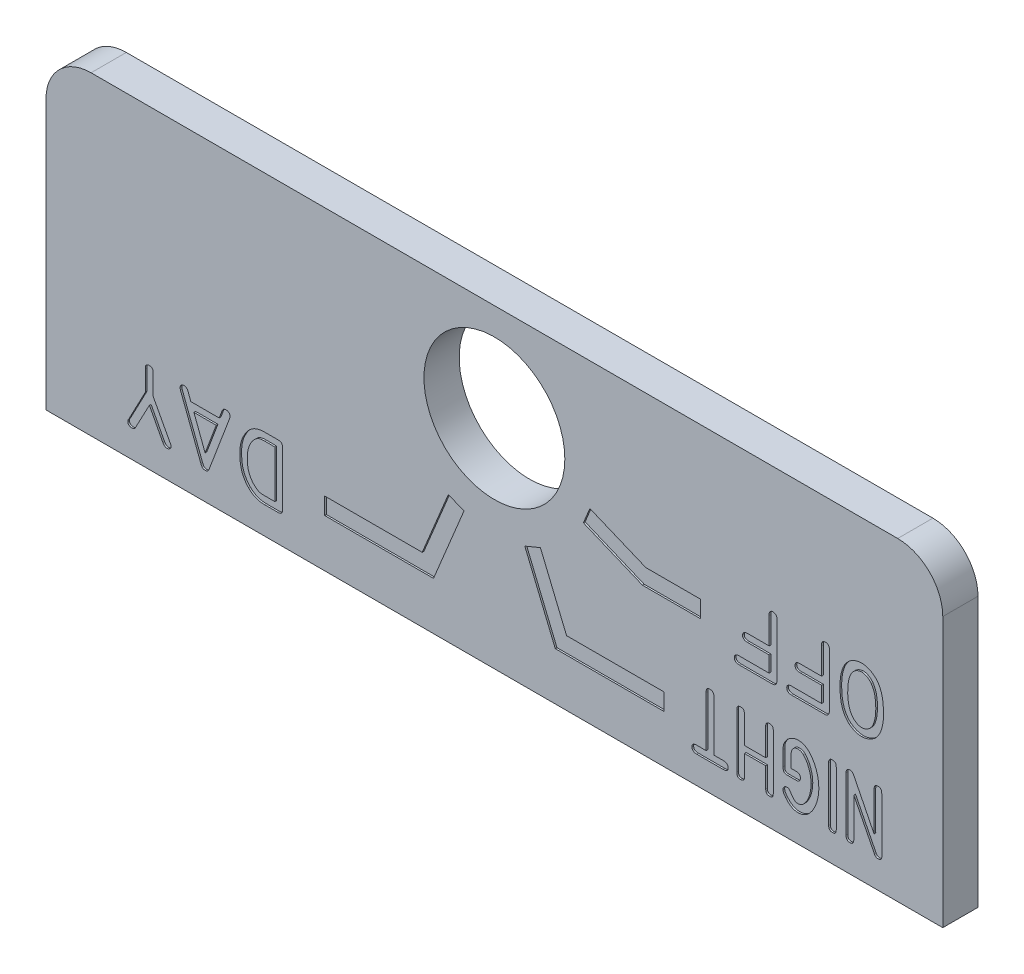
from build123d import *

# Parameters (mm, degrees)
BOSS_EXTRUDE1_DEPTH         = 1.5875
F_1_4_0_25_DIAMETER_HOLE1_D = 6.35
WRAP2_START                 = -0.0762
WRAP2_DEPTH                 = 0.0762


# Read off the part's stored shape, not the designer's step: Wrap2
with BuildPart() as part:
    # Sketch1 → Boss-Extrude1 (new body)
    with BuildSketch(Plane.XY):
        with BuildLine():
            Line((20.20887512, -175.895), (20.20887512, -163.750624988))
            ThreePointArc((20.20887512, -163.750624988), (19.613716099, -162.313784008), (18.17687512, -161.718624988))
            Line((18.17687512, -161.718624988), (-18.176874889, -161.718624988))
            ThreePointArc((-18.176874889, -161.718624988), (-19.613715868, -162.313784008), (-20.208874889, -163.750624988))
            Line((-20.208874889, -163.750624988), (-20.208874889, -175.895))
            Line((-20.208874889, -175.895), (20.20887512, -175.895))
        make_face()
    extrude(amount=BOSS_EXTRUDE1_DEPTH)

    # 1/4 (0.25) Diameter Hole1 (through all)
    with Locations(Plane.XY.offset(1.5875)):
        with Locations((1.87e-07, -166.116000205)):
            Hole(F_1_4_0_25_DIAMETER_HOLE1_D / 2)

    # Wrap2 outline → Wrap2 (cut)
    # profile 1 of 14: a face of its own
    with BuildSketch(Plane.XY.offset(1.5875).offset(WRAP2_START)):
        with BuildLine():
            Line((12.382324915, -169.873855094), (11.037261195, -169.873855094))
            add(Edge.make_bspline(
                [(11.037261195, -169.873855094), (11.019601092, -169.874120268), (10.986451526, -169.874618021), (10.940376467, -169.883636759), (10.900756518, -169.896491722), (10.868346228, -169.9162686), (10.842005802, -169.940923452), (10.824933637, -169.972611401), (10.813013862, -170.008694155), (10.811958214, -170.034880331), (10.811399257, -170.048745708)],
                knots=[0, 0, 0, 0, 0.162518303, 0.305061134, 0.431361212, 0.544321093, 0.652733849, 0.759548786, 0.872682952, 1, 1, 1, 1], degree=3))
            add(Edge.make_bspline(
                [(10.811399257, -170.048745708), (10.812202362, -170.062204438), (10.813743557, -170.088032335), (10.826164179, -170.123715108), (10.843720529, -170.154981547), (10.869953594, -170.179487921), (10.901789871, -170.199891023), (10.941446268, -170.212545557), (10.986932783, -170.221365963), (11.019490971, -170.222847938), (11.036784906, -170.223635119)],
                knots=[0, 0, 0, 0, 0.124823382, 0.239541572, 0.3482555, 0.454921392, 0.569877669, 0.697288114, 0.839208514, 1, 1, 1, 1], degree=3))
            Line((11.036784906, -170.223635119), (12.482269195, -170.223634517))
            add(Edge.make_bspline(
                [(12.482269195, -170.223634517), (12.501724882, -170.224780896), (12.538436193, -170.22694402), (12.590047374, -170.218900246), (12.634521684, -170.202859542), (12.671575932, -170.177252804), (12.698957465, -170.141071738), (12.719099456, -170.097257146), (12.730455334, -170.044584579), (12.731530808, -170.006720258), (12.732103736, -169.986549122)],
                knots=[0, 0, 0, 0, 0.144597592, 0.272843978, 0.385403949, 0.493830313, 0.602546429, 0.718652784, 0.850120297, 1, 1, 1, 1], degree=3))
            Line((12.732103736, -169.986549122), (12.732104338, -167.620497745))
            add(Edge.make_bspline(
                [(12.732104338, -167.620497745), (12.731912791, -167.603909367), (12.731595534, -167.576434248), (12.731036391, -167.540868779), (12.727431454, -167.513970644), (12.721911814, -167.498818004), (12.719171773, -167.49129598)],
                knots=[0, 0, 0, 0, 0.380827035, 0.630758982, 0.816702572, 1, 1, 1, 1], degree=3))
            add(Edge.make_bspline(
                [(12.719171773, -167.49129598), (12.71073442, -167.476714142), (12.694294767, -167.448302341), (12.656140939, -167.416477614), (12.609421512, -167.396543493), (12.575281655, -167.39286567), (12.557214325, -167.390919311)],
                knots=[0, 0, 0, 0, 0.25059774, 0.488274043, 0.729186872, 1, 1, 1, 1], degree=3))
            add(Edge.make_bspline(
                [(12.557214325, -167.390919311), (12.538709775, -167.392483071), (12.502258027, -167.395563492), (12.460436742, -167.415340682), (12.433178497, -167.43760065), (12.416084309, -167.45703149), (12.402965801, -167.47944466), (12.397438742, -167.495899087), (12.39464107, -167.504227943)],
                knots=[0, 0, 0, 0, 0.260463338, 0.513081557, 0.636553784, 0.755600026, 0.876290294, 1, 1, 1, 1], degree=3))
            add(Edge.make_bspline(
                [(12.39464107, -167.504227943), (12.391900622, -167.510920489), (12.386388784, -167.524381143), (12.382780357, -167.548656882), (12.382118502, -167.58078147), (12.382247261, -167.605629695), (12.382324915, -167.620615614)],
                knots=[0, 0, 0, 0, 0.183204339, 0.36847718, 0.619129726, 1, 1, 1, 1], degree=3))
            Line((12.382324915, -167.620615614), (12.382324915, -168.809739845))
            Line((12.382324915, -168.809739845), (11.437375086, -168.809739845))
            add(Edge.make_bspline(
                [(11.437375086, -168.809739845), (11.419395325, -168.809601751), (11.388841571, -168.809367084), (11.349550611, -168.812909192), (11.32039865, -168.816329708), (11.304216789, -168.820652554), (11.296655791, -168.822672409)],
                knots=[0, 0, 0, 0, 0.380151181, 0.646006656, 0.834596108, 1, 1, 1, 1], degree=3))
            add(Edge.make_bspline(
                [(11.296655791, -168.822672409), (11.28041719, -168.829885005), (11.24933757, -168.843689441), (11.213285339, -168.880800704), (11.190911838, -168.928490616), (11.187570273, -168.964052998), (11.18581039, -168.982782433)],
                knots=[0, 0, 0, 0, 0.25460758, 0.487302273, 0.729980427, 1, 1, 1, 1], degree=3))
            add(Edge.make_bspline(
                [(11.18581039, -168.982782433), (11.185961414, -168.997020326), (11.186246604, -169.023906712), (11.19702972, -169.061654716), (11.215846227, -169.09341808), (11.242925423, -169.118755774), (11.277497257, -169.13826977), (11.319904224, -169.151132317), (11.369623807, -169.159262205), (11.405206242, -169.159430025), (11.424128002, -169.159519267)],
                knots=[0, 0, 0, 0, 0.124834503, 0.235733518, 0.341050032, 0.445807504, 0.558269274, 0.68735626, 0.833744654, 1, 1, 1, 1], degree=3))
            Line((11.424128002, -169.159519267), (12.382324915, -169.159519267))
            Line((12.382324915, -169.159519267), (12.382324915, -169.873855094))
        make_face()
    # profile 2 of 14: a face of its own
    with BuildSketch(Plane.XY.offset(1.5875).offset(WRAP2_START)):
        with BuildLine():
            Line((14.747026806, -169.873855094), (13.401963087, -169.873855094))
            add(Edge.make_bspline(
                [(13.401963087, -169.873855094), (13.384302983, -169.874120268), (13.351153418, -169.874618021), (13.305078359, -169.883636759), (13.26545841, -169.896491722), (13.23304812, -169.9162686), (13.206707694, -169.940923452), (13.189635529, -169.972611401), (13.177715754, -170.008694155), (13.176660106, -170.034880331), (13.176101149, -170.048745708)],
                knots=[0, 0, 0, 0, 0.162518303, 0.305061134, 0.431361212, 0.544321093, 0.652733849, 0.759548786, 0.872682952, 1, 1, 1, 1], degree=3))
            add(Edge.make_bspline(
                [(13.176101149, -170.048745708), (13.176904254, -170.062204438), (13.178445448, -170.088032335), (13.19086607, -170.123715108), (13.208422421, -170.154981547), (13.234655486, -170.179487921), (13.266491763, -170.199891023), (13.306148159, -170.212545557), (13.351634674, -170.221365963), (13.384192863, -170.222847938), (13.401486798, -170.223635119)],
                knots=[0, 0, 0, 0, 0.124823382, 0.239541572, 0.3482555, 0.454921392, 0.569877669, 0.697288114, 0.839208514, 1, 1, 1, 1], degree=3))
            Line((13.401486798, -170.223635119), (14.846971087, -170.223634517))
            add(Edge.make_bspline(
                [(14.846971087, -170.223634517), (14.866426774, -170.224780896), (14.903138085, -170.22694402), (14.954749265, -170.218900246), (14.999223576, -170.202859542), (15.036277824, -170.177252804), (15.063659357, -170.141071738), (15.083801348, -170.097257146), (15.095157226, -170.044584579), (15.0962327, -170.006720258), (15.096805628, -169.986549122)],
                knots=[0, 0, 0, 0, 0.144597592, 0.272843978, 0.385403949, 0.493830313, 0.602546429, 0.718652784, 0.850120297, 1, 1, 1, 1], degree=3))
            Line((15.096805628, -169.986549122), (15.096806229, -167.620497745))
            add(Edge.make_bspline(
                [(15.096806229, -167.620497745), (15.096614682, -167.603909367), (15.096297426, -167.576434248), (15.095738283, -167.540868779), (15.092133345, -167.513970644), (15.086613706, -167.498818004), (15.083873664, -167.49129598)],
                knots=[0, 0, 0, 0, 0.380827035, 0.630758982, 0.816702572, 1, 1, 1, 1], degree=3))
            add(Edge.make_bspline(
                [(15.083873664, -167.49129598), (15.075436312, -167.476714142), (15.058996658, -167.448302341), (15.020842831, -167.416477614), (14.974123404, -167.396543493), (14.939983547, -167.39286567), (14.921916217, -167.390919311)],
                knots=[0, 0, 0, 0, 0.25059774, 0.488274043, 0.729186872, 1, 1, 1, 1], degree=3))
            add(Edge.make_bspline(
                [(14.921916217, -167.390919311), (14.903411666, -167.392483071), (14.866959919, -167.395563492), (14.825138634, -167.415340682), (14.797880389, -167.43760065), (14.780786201, -167.45703149), (14.767667693, -167.47944466), (14.762140634, -167.495899087), (14.759342962, -167.504227943)],
                knots=[0, 0, 0, 0, 0.260463338, 0.513081557, 0.636553784, 0.755600026, 0.876290294, 1, 1, 1, 1], degree=3))
            add(Edge.make_bspline(
                [(14.759342962, -167.504227943), (14.756602514, -167.510920489), (14.751090676, -167.524381143), (14.747482249, -167.548656882), (14.746820394, -167.58078147), (14.746949152, -167.605629695), (14.747026806, -167.620615614)],
                knots=[0, 0, 0, 0, 0.183204339, 0.36847718, 0.619129726, 1, 1, 1, 1], degree=3))
            Line((14.747026806, -167.620615614), (14.747026806, -168.809739845))
            Line((14.747026806, -168.809739845), (13.802076978, -168.809739845))
            add(Edge.make_bspline(
                [(13.802076978, -168.809739845), (13.784097217, -168.809601751), (13.753543463, -168.809367084), (13.714252503, -168.812909192), (13.685100542, -168.816329708), (13.66891868, -168.820652554), (13.661357683, -168.822672409)],
                knots=[0, 0, 0, 0, 0.380151181, 0.646006656, 0.834596108, 1, 1, 1, 1], degree=3))
            add(Edge.make_bspline(
                [(13.661357683, -168.822672409), (13.645119082, -168.829885005), (13.614039461, -168.843689441), (13.57798723, -168.880800704), (13.55561373, -168.928490616), (13.552272165, -168.964052998), (13.550512281, -168.982782433)],
                knots=[0, 0, 0, 0, 0.25460758, 0.487302273, 0.729980427, 1, 1, 1, 1], degree=3))
            add(Edge.make_bspline(
                [(13.550512281, -168.982782433), (13.550663306, -168.997020326), (13.550948496, -169.023906712), (13.561731612, -169.061654716), (13.580548119, -169.09341808), (13.607627315, -169.118755774), (13.642199148, -169.13826977), (13.684606115, -169.151132317), (13.734325699, -169.159262205), (13.769908133, -169.159430025), (13.788829894, -169.159519267)],
                knots=[0, 0, 0, 0, 0.124834503, 0.235733518, 0.341050032, 0.445807504, 0.558269274, 0.68735626, 0.833744654, 1, 1, 1, 1], degree=3))
            Line((13.788829894, -169.159519267), (14.747026806, -169.159519267))
            Line((14.747026806, -169.159519267), (14.747026806, -169.873855094))
        make_face()
    # profile 3 of 14: a face of its own
    with BuildSketch(Plane.XY.offset(1.5875).offset(WRAP2_START)):
        with BuildLine():
            add(Edge.make_bspline(
                [(16.555343358, -170.263046216), (16.583829028, -170.261807187), (16.641466414, -170.259300159), (16.727962728, -170.244150535), (16.81448131, -170.21886346), (16.90090388, -170.186149043), (16.984302842, -170.144333832), (17.06357126, -170.096464295), (17.136770095, -170.041473184), (17.180863052, -169.999904736), (17.20286825, -169.979159428)],
                knots=[0, 0, 0, 0, 0.118093103, 0.23894744, 0.362830703, 0.491295328, 0.621428395, 0.748962669, 0.874716356, 1, 1, 1, 1], degree=3))
            add(Edge.make_bspline(
                [(17.20286825, -169.979159428), (17.229781975, -169.946937962), (17.284557589, -169.881359873), (17.352279603, -169.769253388), (17.410678652, -169.645738394), (17.45755369, -169.509925701), (17.494096425, -169.362908355), (17.521181008, -169.205706736), (17.537176617, -169.038331151), (17.53926098, -168.92349466), (17.540330916, -168.864547339)],
                knots=[0, 0, 0, 0, 0.105704853, 0.215133666, 0.329018149, 0.449630503, 0.576639017, 0.710540967, 0.851416267, 1, 1, 1, 1], degree=3))
            add(Edge.make_bspline(
                [(17.540330916, -168.864547339), (17.539544841, -168.804791391), (17.538019349, -168.688826386), (17.525110912, -168.520596771), (17.503427343, -168.363554219), (17.474902346, -168.217255797), (17.4351981, -168.082705324), (17.387668346, -167.959253803), (17.332583093, -167.846219636), (17.286792, -167.778612384), (17.264449029, -167.745624595)],
                knots=[0, 0, 0, 0, 0.153117218, 0.297145964, 0.432018517, 0.559217347, 0.678730148, 0.790971852, 0.898008332, 1, 1, 1, 1], degree=3))
            add(Edge.make_bspline(
                [(17.264449029, -167.745624595), (17.242674982, -167.720404133), (17.198814706, -167.669601616), (17.12121664, -167.603414659), (17.035782664, -167.543199703), (16.942696643, -167.491055559), (16.845003816, -167.448092161), (16.745771241, -167.416466664), (16.646111665, -167.396665929), (16.579549413, -167.39282913), (16.546417152, -167.390919311)],
                knots=[0, 0, 0, 0, 0.121091611, 0.24391935, 0.369915463, 0.501015774, 0.631465458, 0.757614252, 0.879349214, 1, 1, 1, 1], degree=3))
            add(Edge.make_bspline(
                [(16.546417152, -167.390919311), (16.520303473, -167.392062945), (16.467603845, -167.394370897), (16.388404607, -167.407124601), (16.308799682, -167.427421556), (16.229880244, -167.455971601), (16.152859231, -167.490250601), (16.080315525, -167.532368146), (16.011544006, -167.579029811), (15.970261659, -167.615832434), (15.949699409, -167.634163386)],
                knots=[0, 0, 0, 0, 0.119016937, 0.240186307, 0.364723616, 0.49281703, 0.622160895, 0.748261788, 0.874612166, 1, 1, 1, 1], degree=3))
            add(Edge.make_bspline(
                [(15.949699409, -167.634163386), (15.919437971, -167.66688265), (15.858017062, -167.733292148), (15.781342177, -167.8486869), (15.716320338, -167.977063926), (15.664522075, -168.119326104), (15.623059011, -168.274425183), (15.594913582, -168.443309258), (15.577414991, -168.625446352), (15.575607078, -168.751401315), (15.574672468, -168.816514332)],
                knots=[0, 0, 0, 0, 0.104917106, 0.212947712, 0.325253939, 0.443443112, 0.569142725, 0.70317811, 0.846556515, 1, 1, 1, 1], degree=3))
            add(Edge.make_bspline(
                [(15.574672468, -168.816514332), (15.574769759, -168.85265065), (15.574960569, -168.923522661), (15.580556857, -169.027593968), (15.587074002, -169.127749195), (15.59947343, -169.223533904), (15.612985074, -169.315527109), (15.631235774, -169.403155305), (15.651726885, -169.486973927), (15.676618217, -169.566392001), (15.703952515, -169.641897233), (15.73595613, -169.712596722), (15.769124287, -169.780376721), (15.807998264, -169.842809234), (15.848190773, -169.902503396), (15.892854817, -169.957141566), (15.940126856, -170.008296278), (15.974867696, -170.038574745), (15.992190146, -170.05367217)],
                knots=[0, 0, 0, 0, 0.080430845, 0.157744227, 0.231975202, 0.30378836, 0.372682398, 0.438910646, 0.502970405, 0.56468761, 0.624108737, 0.681595454, 0.73738624, 0.791931734, 0.845167542, 0.897479435, 0.948881277, 1, 1, 1, 1], degree=3))
            add(Edge.make_bspline(
                [(15.992190146, -170.05367217), (16.013091421, -170.06961414), (16.054606896, -170.10127912), (16.120992712, -170.142605196), (16.190156828, -170.178488691), (16.261869603, -170.20843554), (16.334918814, -170.232565326), (16.408278592, -170.24974137), (16.481628584, -170.260805487), (16.530573096, -170.262299847), (16.555038461, -170.263046817)],
                knots=[0, 0, 0, 0, 0.128897167, 0.256023952, 0.383031035, 0.510762582, 0.636864263, 0.759967113, 0.880017352, 1, 1, 1, 1], degree=3))
            Line((16.555038461, -170.263046817), (16.555343358, -170.263046216))
        make_face()
        with BuildLine():
            add(Edge.make_bspline(
                [(16.213880949, -169.769784782), (16.190319642, -169.745597933), (16.142400416, -169.696406475), (16.083659124, -169.608540487), (16.033201998, -169.509615843), (15.993349048, -169.398065614), (15.961047589, -169.275135714), (15.939820003, -169.140002636), (15.925702224, -168.993144023), (15.92487879, -168.891064112), (15.92445129, -168.838067604)],
                knots=[0, 0, 0, 0, 0.100870888, 0.205152237, 0.314772278, 0.432547495, 0.558900519, 0.694634529, 0.841464361, 1, 1, 1, 1], degree=3))
            add(Edge.make_bspline(
                [(15.92445129, -168.838067604), (15.925178551, -168.786529117), (15.926576743, -168.687444107), (15.93665406, -168.544864882), (15.954913114, -168.414587264), (15.980627424, -168.296144602), (16.013667162, -168.188519412), (16.05506446, -168.091637656), (16.103048203, -168.003944739), (16.14316622, -167.953277035), (16.162768903, -167.928519507)],
                knots=[0, 0, 0, 0, 0.161184797, 0.309884867, 0.446706464, 0.572255575, 0.688604116, 0.798190394, 0.901390696, 1, 1, 1, 1], degree=3))
            add(Edge.make_bspline(
                [(16.162768903, -167.928519507), (16.175832097, -167.915076408), (16.202135472, -167.888008077), (16.24686048, -167.852849179), (16.294363886, -167.820115015), (16.345694434, -167.793243489), (16.397912923, -167.770070846), (16.450958511, -167.754324567), (16.503045718, -167.743017288), (16.537944915, -167.741460596), (16.555038461, -167.740698132)],
                knots=[0, 0, 0, 0, 0.125942977, 0.253592282, 0.381874678, 0.513443514, 0.64270292, 0.765426277, 0.885106335, 1, 1, 1, 1], degree=3))
            add(Edge.make_bspline(
                [(16.555038461, -167.740698132), (16.574804594, -167.741829486), (16.614490683, -167.744100998), (16.67370388, -167.756943016), (16.732586447, -167.777499954), (16.790533737, -167.805784468), (16.846232455, -167.840475757), (16.89760561, -167.881639642), (16.944983738, -167.92768174), (16.971932354, -167.962655026), (16.985488102, -167.98024736)],
                knots=[0, 0, 0, 0, 0.116371412, 0.233648452, 0.355136566, 0.482643676, 0.612357711, 0.740458571, 0.869444931, 1, 1, 1, 1], degree=3))
            add(Edge.make_bspline(
                [(16.985488102, -167.98024736), (17.00250021, -168.005553401), (17.03730111, -168.057320822), (17.079416709, -168.143736481), (17.114384836, -168.238524792), (17.14271767, -168.341971352), (17.163879765, -168.455304484), (17.17989159, -168.578834124), (17.188902873, -168.71354007), (17.189988394, -168.806853476), (17.190552095, -168.855310222)],
                knots=[0, 0, 0, 0, 0.100095779, 0.204761407, 0.314882772, 0.431712838, 0.556714231, 0.693410658, 0.840791131, 1, 1, 1, 1], degree=3))
            add(Edge.make_bspline(
                [(17.190552095, -168.855310222), (17.189734435, -168.904192525), (17.188147906, -168.999040272), (17.175656066, -169.1366603), (17.155791862, -169.264958456), (17.127500608, -169.383343068), (17.092554995, -169.491100424), (17.049450969, -169.5866355), (16.999337325, -169.670033075), (16.958457869, -169.716929138), (16.938686711, -169.7396102)],
                knots=[0, 0, 0, 0, 0.156015182, 0.302720772, 0.440715865, 0.570082732, 0.690883956, 0.801726531, 0.904105964, 1, 1, 1, 1], degree=3))
            add(Edge.make_bspline(
                [(16.938686711, -169.7396102), (16.926019458, -169.752023918), (16.900466644, -169.777065292), (16.856682002, -169.809533013), (16.809380068, -169.839096459), (16.758728891, -169.864802688), (16.706638414, -169.885172222), (16.655109639, -169.901161613), (16.604689097, -169.910535402), (16.571395567, -169.912370029), (16.555199101, -169.913259177)],
                knots=[0, 0, 0, 0, 0.123371767, 0.248869729, 0.378562781, 0.511522779, 0.643704529, 0.767605082, 0.886756388, 0.999626843, 0.999626843, 0.999626843, 0.999626843], degree=3))
            add(Edge.make_bspline(
                [(16.555199101, -169.913259177), (16.540754854, -169.912496609), (16.511342744, -169.910938554), (16.466767103, -169.903625052), (16.421669669, -169.890070585), (16.360982805, -169.867612203), (16.288594792, -169.830347802), (16.238517279, -169.789754984), (16.213880949, -169.769784782)],
                knots=[0.000382455, 0.000382455, 0.000382455, 0.000382455, 0.115265933, 0.234317535, 0.3582089, 0.488780363, 0.748498375, 1, 1, 1, 1], degree=3))
        make_face(mode=Mode.SUBTRACT)
    # profile 4 of 14: a face of its own
    with BuildSketch(Plane.XY.offset(1.5875).offset(WRAP2_START)):
        with BuildLine():
            Line((9.544353084, -174.316399015), (9.122956539, -174.316399015))
            add(Edge.make_bspline(
                [(9.122956539, -174.316399015), (9.105947805, -174.317016313), (9.073919206, -174.318178728), (9.029330538, -174.325945124), (8.9912611, -174.338823208), (8.959542138, -174.357093596), (8.935544926, -174.382208624), (8.917633709, -174.411687223), (8.907883348, -174.446987078), (8.906494714, -174.47193776), (8.905760412, -174.48513155)],
                knots=[0, 0, 0, 0, 0.162897657, 0.306747336, 0.431731416, 0.546374995, 0.653433857, 0.760997037, 0.873616484, 1, 1, 1, 1], degree=3))
            add(Edge.make_bspline(
                [(8.905760412, -174.48513155), (8.906463754, -174.499362046), (8.907787883, -174.526152748), (8.917800962, -174.563773561), (8.934400677, -174.595799955), (8.958066578, -174.621886785), (8.988034053, -174.642110694), (9.02447241, -174.655948351), (9.067113047, -174.664606715), (9.097640165, -174.665632535), (9.113903443, -174.666179039)],
                knots=[0, 0, 0, 0, 0.13549594, 0.255088173, 0.36798027, 0.476021954, 0.587257675, 0.709320559, 0.84514094, 1, 1, 1, 1], degree=3))
            Line((9.113903443, -174.666179039), (10.30275946, -174.666178438))
            add(Edge.make_bspline(
                [(10.30275946, -174.666178438), (10.320950504, -174.66610885), (10.354992388, -174.665978627), (10.402516806, -174.657691918), (10.442911716, -174.645092533), (10.477038, -174.627604799), (10.502227483, -174.602406123), (10.52105226, -174.572747121), (10.530675546, -174.536810105), (10.531613423, -174.511455003), (10.53210877, -174.498063514)],
                knots=[0, 0, 0, 0, 0.167323449, 0.313121427, 0.442287347, 0.556528349, 0.662166905, 0.766596956, 0.876726412, 1, 1, 1, 1], degree=3))
            add(Edge.make_bspline(
                [(10.53210877, -174.498063514), (10.531409289, -174.483829217), (10.530092426, -174.457031359), (10.520030625, -174.419458525), (10.503535124, -174.387141951), (10.47892384, -174.361372078), (10.44879771, -174.340345899), (10.411310678, -174.326590718), (10.367671221, -174.31798434), (10.336329452, -174.316950329), (10.319655085, -174.316400217)],
                knots=[0, 0, 0, 0, 0.13367795, 0.251665576, 0.363042966, 0.47093762, 0.583363643, 0.705585, 0.843366093, 1, 1, 1, 1], degree=3))
            Line((10.319655085, -174.316400217), (9.894132507, -174.316399015))
            Line((9.894132507, -174.316399015), (9.894132507, -172.070548025))
            add(Edge.make_bspline(
                [(9.894132507, -172.070548025), (9.894260497, -172.057202432), (9.894494893, -172.032761794), (9.893057295, -171.999518673), (9.891639227, -171.972719284), (9.887656716, -171.946395999), (9.880182364, -171.918339056), (9.866835453, -171.901080251), (9.860262478, -171.892580778)],
                knots=[0, 0, 0, 0, 0.216060692, 0.395685733, 0.538969935, 0.649917571, 0.82759431, 1, 1, 1, 1], degree=3))
            add(Edge.make_bspline(
                [(9.860262478, -171.892580778), (9.850959755, -171.883721002), (9.832443218, -171.866086125), (9.79806552, -171.847297162), (9.758931395, -171.836073373), (9.731226259, -171.834357817), (9.716779264, -171.833463231)],
                knots=[0, 0, 0, 0, 0.240761183, 0.479221355, 0.728437127, 1, 1, 1, 1], degree=3))
            add(Edge.make_bspline(
                [(9.716779264, -171.833463231), (9.70277088, -171.833257304), (9.67647633, -171.832870765), (9.63951865, -171.841662966), (9.608126681, -171.857766344), (9.583368964, -171.882616517), (9.563872878, -171.914101142), (9.551576809, -171.953190019), (9.54397161, -171.999019225), (9.544219702, -172.031922045), (9.544353084, -172.049611763)],
                knots=[0, 0, 0, 0, 0.1303468, 0.244668505, 0.350952396, 0.455284039, 0.568004952, 0.693428508, 0.835176339, 1, 1, 1, 1], degree=3))
            Line((9.544353084, -172.049611763), (9.544353084, -174.316399015))
        make_face()
    # profile 5 of 14: a face of its own
    with BuildSketch(Plane.XY.offset(1.5875).offset(WRAP2_START)):
        with BuildLine():
            Line((12.228043408, -173.562650888), (12.228043408, -174.469104311))
            add(Edge.make_bspline(
                [(12.228043408, -174.469104311), (12.228319522, -174.485172157), (12.228837533, -174.515316714), (12.237684474, -174.557069012), (12.2509649, -174.592316986), (12.269835925, -174.621482376), (12.295105158, -174.643406481), (12.325799212, -174.658591981), (12.361887664, -174.6665731), (12.387500575, -174.666315609), (12.401085396, -174.666179039)],
                knots=[0, 0, 0, 0, 0.158754578, 0.297836197, 0.420091928, 0.529986913, 0.637987015, 0.747033378, 0.865829146, 1, 1, 1, 1], degree=3))
            add(Edge.make_bspline(
                [(12.401085396, -174.666179039), (12.415113182, -174.666185857), (12.441237271, -174.666198556), (12.477304308, -174.657018261), (12.507889546, -174.643381852), (12.532050147, -174.621517309), (12.550335121, -174.592682255), (12.562165797, -174.555682843), (12.569334458, -174.510866614), (12.570046954, -174.4781854), (12.570432536, -174.460499239)],
                knots=[0, 0, 0, 0, 0.135176046, 0.251739713, 0.357443824, 0.455903755, 0.562221727, 0.68406271, 0.82902355, 1, 1, 1, 1], degree=3))
            Line((12.570432536, -174.460499239), (12.570433138, -172.027671206))
            add(Edge.make_bspline(
                [(12.570433138, -172.027671206), (12.570548202, -172.011953978), (12.570765783, -171.982233493), (12.563110912, -171.940894047), (12.551410458, -171.905237136), (12.53243559, -171.876587395), (12.507584204, -171.854798488), (12.476700609, -171.84032676), (12.440408075, -171.833300901), (12.414659039, -171.833407197), (12.401085396, -171.833463231)],
                knots=[0, 0, 0, 0, 0.156476393, 0.295888969, 0.417683259, 0.528456213, 0.634429154, 0.743446119, 0.864757234, 1, 1, 1, 1], degree=3))
            add(Edge.make_bspline(
                [(12.401085396, -171.833463231), (12.387101057, -171.833396118), (12.360740177, -171.833269608), (12.323646864, -171.840330718), (12.292171767, -171.854780936), (12.266672228, -171.876530509), (12.247149775, -171.905176567), (12.234404469, -171.940703163), (12.227981931, -171.982453842), (12.228022073, -172.012231686), (12.228043408, -172.028058491)],
                knots=[0, 0, 0, 0, 0.137644544, 0.259463909, 0.36898459, 0.475203523, 0.585765865, 0.706776014, 0.844152622, 1, 1, 1, 1], degree=3))
            Line((12.228043408, -172.028058491), (12.228043408, -173.252283765))
            Line((12.228043408, -173.252283765), (11.269847097, -173.252283765))
            Line((11.269847097, -173.252283765), (11.269847097, -172.044858497))
            add(Edge.make_bspline(
                [(11.269847097, -172.044858497), (11.269730357, -172.026493179), (11.269513069, -171.992309778), (11.262060349, -171.945740883), (11.251251682, -171.907380998), (11.233324954, -171.877969324), (11.209122139, -171.856290965), (11.178398414, -171.842498779), (11.141661237, -171.83343065), (11.114934088, -171.833451806), (11.100499355, -171.833463231)],
                knots=[0, 0, 0, 0, 0.17354588, 0.323021273, 0.445288841, 0.548252678, 0.644568978, 0.74797174, 0.863885195, 1, 1, 1, 1], degree=3))
            add(Edge.make_bspline(
                [(11.100499355, -171.833463231), (11.085693624, -171.833834763), (11.058282939, -171.834522601), (11.020051284, -171.842003206), (10.989061199, -171.857094521), (10.963895617, -171.878281565), (10.946389189, -171.908005402), (10.934402745, -171.944915404), (10.928018217, -171.990277842), (10.92765508, -172.023113075), (10.927457368, -172.040990454)],
                knots=[0, 0, 0, 0, 0.140408875, 0.259946867, 0.366185458, 0.464181939, 0.56737934, 0.688680431, 0.830499811, 1, 1, 1, 1], degree=3))
            Line((10.927457368, -172.040990454), (10.927457368, -174.469104311))
            add(Edge.make_bspline(
                [(10.927457368, -174.469104311), (10.927589655, -174.485772884), (10.927836206, -174.51683919), (10.935201194, -174.559602118), (10.946924329, -174.595200703), (10.965417761, -174.623177557), (10.990062492, -174.64352043), (11.020132183, -174.658138951), (11.056399894, -174.665800164), (11.082403116, -174.666047771), (11.096188701, -174.666179039)],
                knots=[0, 0, 0, 0, 0.165150309, 0.307801387, 0.42892022, 0.534561023, 0.635748817, 0.742327972, 0.863395415, 1, 1, 1, 1], degree=3))
            add(Edge.make_bspline(
                [(11.096188701, -174.666179039), (11.109599117, -174.665669483), (11.135333045, -174.664691671), (11.171307986, -174.655063012), (11.203203744, -174.640931014), (11.230135921, -174.620524674), (11.250731783, -174.593874885), (11.26546058, -174.562659789), (11.271127719, -174.526164046), (11.270289777, -174.500939088), (11.269846496, -174.487594781)],
                knots=[0, 0, 0, 0, 0.139999091, 0.268651369, 0.386841275, 0.503242258, 0.617947069, 0.736136976, 0.860413278, 1, 1, 1, 1], degree=3))
            Line((11.269846496, -174.487594781), (11.269847097, -174.478408782))
            Line((11.269847097, -174.478408782), (11.269847097, -173.562650888))
            Line((11.269847097, -173.562650888), (12.228043408, -173.562650888))
        make_face()
    # profile 6 of 14: a face of its own
    with BuildSketch(Plane.XY.offset(1.5875).offset(WRAP2_START)):
        with BuildLine():
            Line((13.361990299, -173.094636972), (13.361990299, -172.651857945))
            add(Edge.make_bspline(
                [(13.361990299, -172.651857945), (13.363112819, -172.615665904), (13.365230092, -172.547401279), (13.380996666, -172.452124543), (13.406123417, -172.370608548), (13.442301036, -172.303428222), (13.488439333, -172.249509837), (13.546511923, -172.21193246), (13.614116898, -172.188100781), (13.662664881, -172.184913485), (13.688123665, -172.183242053)],
                knots=[0, 0, 0, 0, 0.168347535, 0.317533382, 0.448032111, 0.563451919, 0.6703855, 0.774504603, 0.88174918, 1, 1, 1, 1], degree=3))
            add(Edge.make_bspline(
                [(13.688123665, -172.183242053), (13.710860947, -172.18501766), (13.755542394, -172.188506938), (13.819719788, -172.209223317), (13.879311591, -172.241179133), (13.913029935, -172.271377398), (13.930136124, -172.28669776)],
                knots=[0, 0, 0, 0, 0.253184607, 0.497537694, 0.745087852, 1, 1, 1, 1], degree=3))
            add(Edge.make_bspline(
                [(13.930136124, -172.28669776), (13.956020126, -172.316780766), (14.008470779, -172.377740167), (14.076533527, -172.480167609), (14.133998946, -172.593898727), (14.183557484, -172.716229176), (14.223347439, -172.845615467), (14.252406356, -172.979679033), (14.269971107, -173.117368207), (14.272488523, -173.210359289), (14.273756868, -173.257210828)],
                knots=[0, 0, 0, 0, 0.113066692, 0.229115332, 0.349509146, 0.47578399, 0.604987759, 0.734921021, 0.866445706, 1, 1, 1, 1], degree=3))
            add(Edge.make_bspline(
                [(14.273756868, -173.257210828), (14.272744775, -173.291106173), (14.270747251, -173.358003975), (14.260414533, -173.456846672), (14.245924365, -173.55268125), (14.226138639, -173.645413634), (14.201501554, -173.734871774), (14.171929004, -173.821556375), (14.136887474, -173.905053537), (14.097270111, -173.984517953), (14.054160141, -174.057650222), (14.00872719, -174.122938132), (13.960624601, -174.178682588), (13.910576091, -174.225312038), (13.858633676, -174.263267992), (13.803643054, -174.290178331), (13.747048767, -174.309996383), (13.707779592, -174.31426406), (13.688123665, -174.316400217)],
                knots=[0, 0, 0, 0, 0.077929163, 0.153805484, 0.228283808, 0.300657576, 0.371634944, 0.441472223, 0.511055568, 0.579639748, 0.645433537, 0.706048624, 0.762247154, 0.814337373, 0.863047886, 0.9094741, 0.954687857, 1, 1, 1, 1], degree=3))
            add(Edge.make_bspline(
                [(13.688123665, -174.316400217), (13.672446585, -174.316000232), (13.641243138, -174.315204106), (13.595486013, -174.3027571), (13.551843453, -174.282241527), (13.510019274, -174.25192564), (13.468931496, -174.211412072), (13.427566919, -174.15943403), (13.382855892, -174.097379353), (13.355007051, -174.050615808), (13.340192267, -174.025738943)],
                knots=[0, 0, 0, 0, 0.098370228, 0.195794771, 0.29574629, 0.400393971, 0.519132588, 0.657714484, 0.817913924, 1, 1, 1, 1], degree=3))
            add(Edge.make_bspline(
                [(13.340192267, -174.025738943), (13.334466798, -174.015936958), (13.323785639, -173.997650843), (13.305437753, -173.974215234), (13.28851746, -173.95462139), (13.265640493, -173.935682601), (13.231967492, -173.919657279), (13.202877871, -173.91815329), (13.187471936, -173.917356773)],
                knots=[0, 0, 0, 0, 0.171621566, 0.320168961, 0.4499824, 0.562586526, 0.768344755, 1, 1, 1, 1], degree=3))
            add(Edge.make_bspline(
                [(13.187471936, -173.917356773), (13.174884924, -173.918330535), (13.150496656, -173.92021727), (13.115528252, -173.930719358), (13.085011415, -173.949245015), (13.058223448, -173.973343784), (13.036864744, -174.00313867), (13.020555317, -174.036802589), (13.010419306, -174.074641156), (13.009006508, -174.101213684), (13.008271871, -174.115031072)],
                knots=[0, 0, 0, 0, 0.127211996, 0.246482662, 0.364450575, 0.484724738, 0.607803529, 0.731976066, 0.86063084, 1, 1, 1, 1], degree=3))
            add(Edge.make_bspline(
                [(13.008271871, -174.115031072), (13.009289427, -174.1314159), (13.011452859, -174.166251755), (13.029095316, -174.209052213), (13.049036694, -174.246745856), (13.070785407, -174.27980035), (13.096793707, -174.318126702), (13.116908026, -174.344223387), (13.127738581, -174.358275147)],
                knots=[0, 0, 0, 0, 0.177504855, 0.377393872, 0.496239419, 0.641777771, 0.807115248, 1, 1, 1, 1], degree=3))
            add(Edge.make_bspline(
                [(13.127738581, -174.358275147), (13.149134487, -174.383233045), (13.190470015, -174.431450113), (13.256242045, -174.496027461), (13.323966149, -174.549358295), (13.392513389, -174.593317938), (13.463865872, -174.626342047), (13.537443306, -174.649941878), (13.6141055, -174.663894708), (13.666102923, -174.665411127), (13.692434319, -174.666179039)],
                knots=[0, 0, 0, 0, 0.147817219, 0.285573448, 0.413753257, 0.534904836, 0.650968732, 0.766295941, 0.881652708, 1, 1, 1, 1], degree=3))
            add(Edge.make_bspline(
                [(13.692434319, -174.666179039), (13.711959212, -174.665483446), (13.751163722, -174.664086748), (13.809739536, -174.655961717), (13.868072471, -174.642325985), (13.925525066, -174.622989132), (13.981842243, -174.60020958), (14.03477311, -174.572178672), (14.084680189, -174.541045457), (14.114710461, -174.516459234), (14.129657846, -174.504221592)],
                knots=[0, 0, 0, 0, 0.12322214, 0.247420742, 0.372467494, 0.50067428, 0.629605311, 0.755327797, 0.8782159, 1, 1, 1, 1], degree=3))
            add(Edge.make_bspline(
                [(14.129657846, -174.504221592), (14.148358955, -174.48617582), (14.186102981, -174.449754445), (14.238820315, -174.390740066), (14.288267355, -174.327368344), (14.334913425, -174.260668785), (14.378331208, -174.189637913), (14.418937978, -174.114961512), (14.455583117, -174.035681172), (14.501829493, -173.925998478), (14.548849037, -173.783362232), (14.591303689, -173.607810693), (14.61712272, -173.427726436), (14.620977724, -173.306146736), (14.622919881, -173.244894673)],
                knots=[0, 0, 0, 0, 0.056143524, 0.113313213, 0.170812333, 0.229752765, 0.289090758, 0.350616575, 0.413320695, 0.47773966, 0.607767051, 0.737299464, 0.867651017, 1, 1, 1, 1], degree=3))
            add(Edge.make_bspline(
                [(14.622919881, -173.244894673), (14.621870685, -173.19990927), (14.619772477, -173.109946427), (14.605974131, -172.975765387), (14.583118754, -172.842649843), (14.55105645, -172.711707638), (14.511637789, -172.584120006), (14.463447442, -172.462473695), (14.407567506, -172.347269767), (14.363818647, -172.27509294), (14.342111532, -172.239280561)],
                knots=[0, 0, 0, 0, 0.127601016, 0.255179445, 0.382206594, 0.510437087, 0.637324037, 0.760694093, 0.881262255, 1, 1, 1, 1], degree=3))
            add(Edge.make_bspline(
                [(14.342111532, -172.239280561), (14.31992588, -172.206812276), (14.277115267, -172.144159744), (14.205237301, -172.060429852), (14.129936332, -171.989397694), (14.050683727, -171.931681426), (13.968296488, -171.886408023), (13.881989085, -171.855604204), (13.792663018, -171.836142498), (13.731740786, -171.834360688), (13.701055628, -171.833463231)],
                knots=[0, 0, 0, 0, 0.148531195, 0.2866137, 0.416148245, 0.538890943, 0.656218703, 0.770086885, 0.884197936, 1, 1, 1, 1], degree=3))
            add(Edge.make_bspline(
                [(13.701055628, -171.833463231), (13.671811795, -171.834668348), (13.613397822, -171.837075545), (13.527593319, -171.855882358), (13.444020587, -171.884408607), (13.363608271, -171.923697009), (13.287844702, -171.973566666), (13.21868403, -172.033248345), (13.155299672, -172.10151008), (13.119918667, -172.153190587), (13.101874654, -172.179547206)],
                knots=[0, 0, 0, 0, 0.121526163, 0.242746086, 0.363695153, 0.488163289, 0.613892727, 0.739824884, 0.867312901, 1, 1, 1, 1], degree=3))
            add(Edge.make_bspline(
                [(13.101874654, -172.179547206), (13.086793607, -172.205368067), (13.057347088, -172.255784622), (13.033628712, -172.325369608), (13.02233788, -172.383536225), (13.016083143, -172.43165834), (13.013454342, -172.484547642), (13.012880473, -172.521319172), (13.012582525, -172.540410568)],
                knots=[0, 0, 0, 0, 0.237169953, 0.4630865, 0.579518011, 0.707777812, 0.848281279, 1, 1, 1, 1], degree=3))
            Line((13.012582525, -172.540410568), (13.012954776, -173.207062786))
            add(Edge.make_bspline(
                [(13.012954776, -173.207062786), (13.012404683, -173.227909464), (13.011394426, -173.266194831), (13.01883474, -173.318814632), (13.031543011, -173.361752805), (13.05263848, -173.396178683), (13.08476786, -173.419733491), (13.125780594, -173.435809137), (13.176931137, -173.443435973), (13.214140093, -173.444072162), (13.234273328, -173.444416395)],
                knots=[0, 0, 0, 0, 0.161147403, 0.295950622, 0.409493386, 0.505997804, 0.602279666, 0.712024537, 0.844180591, 1, 1, 1, 1], degree=3))
            Line((13.234273328, -173.444416395), (13.561355062, -173.444416395))
            add(Edge.make_bspline(
                [(13.561355062, -173.444416395), (13.577756692, -173.444395373), (13.607751603, -173.444356929), (13.648333856, -173.441795792), (13.680697802, -173.435916856), (13.697877932, -173.427683454), (13.705366283, -173.424094738)],
                knots=[0, 0, 0, 0, 0.33480643, 0.612286046, 0.831006057, 1, 1, 1, 1], degree=3))
            add(Edge.make_bspline(
                [(13.705366283, -173.424094738), (13.717677696, -173.416138379), (13.743273876, -173.399596624), (13.770578066, -173.360716571), (13.790644842, -173.315645376), (13.793317667, -173.282472391), (13.794658412, -173.265832137)],
                knots=[0, 0, 0, 0, 0.229739325, 0.477642069, 0.737974482, 1, 1, 1, 1], degree=3))
            add(Edge.make_bspline(
                [(13.794658412, -173.265832137), (13.792856522, -173.248798352), (13.789430224, -173.216408548), (13.7708174, -173.172582136), (13.74314753, -173.136139571), (13.71806374, -173.120033242), (13.705366283, -173.111880191)],
                knots=[0, 0, 0, 0, 0.274827374, 0.522585212, 0.75833183, 1, 1, 1, 1], degree=3))
            add(Edge.make_bspline(
                [(13.705366283, -173.111880191), (13.69721119, -173.109019452), (13.680348108, -173.10310402), (13.651609139, -173.097464054), (13.61572792, -173.094510324), (13.588985466, -173.094591069), (13.573583417, -173.094637573)],
                knots=[0, 0, 0, 0, 0.193640478, 0.400409359, 0.654671762, 1, 1, 1, 1], degree=3))
            Line((13.573583417, -173.094637573), (13.361990299, -173.094636972))
        make_face()
    # profile 7 of 14: a face of its own
    with BuildSketch(Plane.XY.offset(1.5875).offset(WRAP2_START)):
        with BuildLine():
            add(Edge.make_bspline(
                [(15.065685678, -174.476140997), (15.065754334, -174.491503414), (15.065883044, -174.520303738), (15.074222211, -174.560289394), (15.086790154, -174.594490427), (15.105496953, -174.622295414), (15.130009829, -174.643801682), (15.160376345, -174.657712813), (15.195801631, -174.665900812), (15.221025203, -174.66608255), (15.234417011, -174.666179039)],
                knots=[0, 0, 0, 0, 0.156429936, 0.29326328, 0.414660319, 0.526240108, 0.631690942, 0.743211699, 0.863664847, 1, 1, 1, 1], degree=3))
            add(Edge.make_bspline(
                [(15.234417011, -174.666179039), (15.248213041, -174.666321698), (15.27424277, -174.666590862), (15.310845201, -174.658519438), (15.342402122, -174.64367252), (15.367396554, -174.620564367), (15.387386863, -174.591261184), (15.399581927, -174.554246173), (15.407834885, -174.511164641), (15.407991769, -174.48004793), (15.408074806, -174.463578278)],
                knots=[0, 0, 0, 0, 0.133192919, 0.251302396, 0.359720634, 0.466653746, 0.576877875, 0.699449588, 0.840922754, 1, 1, 1, 1], degree=3))
            Line((15.408074806, -174.463578278), (15.408075408, -172.027637529))
            add(Edge.make_bspline(
                [(15.408075408, -172.027637529), (15.407835918, -172.01772067), (15.407388233, -171.99918279), (15.407262786, -171.973626213), (15.405340107, -171.952642569), (15.402394097, -171.932069738), (15.39639282, -171.91090193), (15.385943319, -171.898481247), (15.380979264, -171.892580778)],
                knots=[0, 0, 0, 0, 0.210952489, 0.394339768, 0.543330692, 0.658159247, 0.837607901, 1, 1, 1, 1], degree=3))
            add(Edge.make_bspline(
                [(15.380979264, -171.892580778), (15.370824308, -171.883547832), (15.350696325, -171.865643768), (15.315173246, -171.846183399), (15.275659725, -171.835608033), (15.248436757, -171.834192319), (15.234417011, -171.833463231)],
                knots=[0, 0, 0, 0, 0.250727995, 0.49696411, 0.740938031, 1, 1, 1, 1], degree=3))
            add(Edge.make_bspline(
                [(15.234417011, -171.833463231), (15.221022409, -171.833556413), (15.195793573, -171.833731921), (15.160403397, -171.841961473), (15.129793335, -171.855789062), (15.10550787, -171.878057375), (15.08662545, -171.906548512), (15.074269477, -171.94186792), (15.065901465, -171.982917365), (15.065760489, -172.012408497), (15.065685678, -172.028058491)],
                knots=[0, 0, 0, 0, 0.134442412, 0.25322331, 0.363195825, 0.468548979, 0.580292874, 0.70386495, 0.842850663, 1, 1, 1, 1], degree=3))
            Line((15.065685678, -172.028058491), (15.065685678, -174.476140997))
        make_face()
    # profile 8 of 14: a face of its own
    with BuildSketch(Plane.XY.offset(1.5875).offset(WRAP2_START)):
        with BuildLine():
            Line((16.199632569, -172.722271115), (17.12879691, -174.557965254))
            add(Edge.make_bspline(
                [(17.12879691, -174.557965254), (17.138231134, -174.575460812), (17.156070079, -174.608542741), (17.196968278, -174.645092772), (17.245828455, -174.666311313), (17.280530703, -174.666224338), (17.298604704, -174.666179039)],
                knots=[0, 0, 0, 0, 0.27537767, 0.520704985, 0.750368369, 1, 1, 1, 1], degree=3))
            add(Edge.make_bspline(
                [(17.298604704, -174.666179039), (17.310172961, -174.665876528), (17.332892748, -174.665282403), (17.364882688, -174.655637348), (17.394204971, -174.640578168), (17.409970297, -174.625760295), (17.418071414, -174.618146032)],
                knots=[0, 0, 0, 0, 0.260922121, 0.512444992, 0.749466618, 1, 1, 1, 1], degree=3))
            add(Edge.make_bspline(
                [(17.418071414, -174.618146032), (17.426314488, -174.610436769), (17.442622409, -174.59518493), (17.453933515, -174.567692725), (17.457182106, -174.541646236), (17.459826599, -174.515571567), (17.460802892, -174.483290015), (17.460646461, -174.459677512), (17.460562151, -174.446951468)],
                knots=[0, 0, 0, 0, 0.183207082, 0.362452968, 0.471352222, 0.613208043, 0.791537064, 1, 1, 1, 1], degree=3))
            Line((17.460562151, -174.446951468), (17.46080631, -172.061764345))
            add(Edge.make_bspline(
                [(17.46080631, -172.061764345), (17.46020133, -172.042514876), (17.45907573, -172.006700088), (17.453241962, -171.957255263), (17.440915967, -171.91679869), (17.423771675, -171.884209568), (17.399004304, -171.86028232), (17.36803391, -171.844084046), (17.331043468, -171.834004204), (17.304218263, -171.833650778), (17.289983395, -171.833463231)],
                knots=[0, 0, 0, 0, 0.174801586, 0.325228793, 0.450134547, 0.55688528, 0.655684646, 0.757374454, 0.871250096, 1, 1, 1, 1], degree=3))
            add(Edge.make_bspline(
                [(17.289983395, -171.833463231), (17.276180942, -171.833994401), (17.250071205, -171.834999202), (17.213327789, -171.844078526), (17.182254219, -171.860616567), (17.156311772, -171.883223323), (17.136098176, -171.912634248), (17.122205507, -171.948457819), (17.113767886, -171.990323231), (17.112219843, -172.020216101), (17.111399138, -172.036063992)],
                knots=[0, 0, 0, 0, 0.134289682, 0.254032258, 0.364905212, 0.473961644, 0.58596388, 0.708818882, 0.845628511, 1, 1, 1, 1], degree=3))
            Line((17.111399138, -172.036063992), (17.111770787, -173.781655349))
            Line((17.111770787, -173.781655349), (16.186862976, -171.933094195))
            add(Edge.make_bspline(
                [(16.186862976, -171.933094195), (16.177186472, -171.917802719), (16.158682415, -171.88856134), (16.119893611, -171.854590821), (16.072194137, -171.835995086), (16.03840926, -171.83433061), (16.020803552, -171.833463231)],
                knots=[0, 0, 0, 0, 0.264616796, 0.506017836, 0.742579929, 1, 1, 1, 1], degree=3))
            add(Edge.make_bspline(
                [(16.020803552, -171.833463231), (16.007605563, -171.833730247), (15.982475512, -171.834238667), (15.947337669, -171.843622521), (15.917356745, -171.859348687), (15.892610901, -171.881428547), (15.873743632, -171.910385431), (15.860556596, -171.9454733), (15.851793354, -171.986587312), (15.850768334, -172.016102365), (15.850224796, -172.031753338)],
                knots=[0, 0, 0, 0, 0.132047675, 0.251429568, 0.361053185, 0.468961391, 0.580331114, 0.704227458, 0.843160432, 1, 1, 1, 1], degree=3))
            Line((15.850224796, -172.031753338), (15.850597047, -174.455029134))
            add(Edge.make_bspline(
                [(15.850597047, -174.455029134), (15.850826803, -174.473099466), (15.851249825, -174.506370059), (15.858455979, -174.552267168), (15.870841843, -174.590066919), (15.889838082, -174.61992806), (15.915190513, -174.641892275), (15.946438801, -174.65672946), (15.98380555, -174.665348068), (16.010695073, -174.665888982), (16.025114206, -174.666179039)],
                knots=[0, 0, 0, 0, 0.169958689, 0.312923198, 0.435768891, 0.541897184, 0.641883299, 0.747323185, 0.864505568, 1, 1, 1, 1], degree=3))
            add(Edge.make_bspline(
                [(16.025114206, -174.666179039), (16.039760653, -174.666224212), (16.067153933, -174.666308699), (16.104990508, -174.656574896), (16.136998377, -174.641659279), (16.161832959, -174.617743959), (16.180240907, -174.58586197), (16.191640453, -174.544904629), (16.199055484, -174.495258566), (16.199271249, -174.459096955), (16.199387809, -174.439561774)],
                knots=[0, 0, 0, 0, 0.131102332, 0.245200967, 0.348332088, 0.444901594, 0.54994559, 0.675410014, 0.824650403, 1, 1, 1, 1], degree=3))
            Line((16.199387809, -174.439561774), (16.199632569, -172.722271115))
        make_face()
    # profile 9 of 14: a face of its own
    with BuildSketch(Plane.XY.offset(1.5875).offset(WRAP2_START)):
        with BuildLine():
            Line((-9.544352432, -174.445719967), (-9.544351831, -172.090543852))
            add(Edge.make_bspline(
                [(-9.544351831, -172.090543852), (-9.543553087, -172.06827094), (-9.542072077, -172.026973054), (-9.548473871, -171.970128394), (-9.561453196, -171.923876667), (-9.582212422, -171.886871567), (-9.614466188, -171.861266153), (-9.655209563, -171.843219375), (-9.706329412, -171.834065176), (-9.743434115, -171.833675124), (-9.763580003, -171.833463346)],
                knots=[0, 0, 0, 0, 0.165632283, 0.307111316, 0.423529841, 0.521468483, 0.616874736, 0.724163315, 0.850235297, 1, 1, 1, 1], degree=3))
            Line((-9.763580003, -171.833463346), (-10.364268023, -171.833463346))
            add(Edge.make_bspline(
                [(-10.364268023, -171.833463346), (-10.389444431, -171.833683452), (-10.438959774, -171.834116342), (-10.511801649, -171.841543109), (-10.58227493, -171.851499094), (-10.650235669, -171.866966367), (-10.715584671, -171.887455419), (-10.778474425, -171.911898995), (-10.83860308, -171.941287678), (-10.896718224, -171.974368982), (-10.952281354, -172.012755263), (-11.005461342, -172.056160081), (-11.056396313, -172.104383243), (-11.106334113, -172.156943434), (-11.153185907, -172.215358295), (-11.19831686, -172.27852983), (-11.241577792, -172.34632378), (-11.268047297, -172.394110508), (-11.281546192, -172.418480741)],
                knots=[0, 0, 0, 0, 0.065536979, 0.128893921, 0.190512845, 0.250819081, 0.310169911, 0.368742757, 0.426366175, 0.48432095, 0.542747229, 0.602028193, 0.662919254, 0.725321696, 0.790696744, 0.857752969, 0.927456984, 1, 1, 1, 1], degree=3))
            add(Edge.make_bspline(
                [(-11.281546192, -172.418480741), (-11.298520827, -172.450237631), (-11.33198518, -172.512844204), (-11.371904103, -172.609921271), (-11.405796515, -172.706135734), (-11.43148954, -172.80417027), (-11.449954905, -172.906937069), (-11.462681478, -173.017791505), (-11.470032397, -173.138257812), (-11.470405776, -173.221894063), (-11.470599181, -173.265216445)],
                knots=[0, 0, 0, 0, 0.122913588, 0.242315879, 0.35805373, 0.471138686, 0.588025999, 0.714382504, 0.852054224, 1, 1, 1, 1], degree=3))
            add(Edge.make_bspline(
                [(-11.470599181, -173.265216445), (-11.469724992, -173.323771605), (-11.468030468, -173.437274691), (-11.449577394, -173.60177341), (-11.42094633, -173.755196224), (-11.378082559, -173.897579303), (-11.322325159, -174.030581135), (-11.251763092, -174.154804194), (-11.169121913, -174.27309019), (-11.103042133, -174.343629371), (-11.069708314, -174.379212726)],
                knots=[0, 0, 0, 0, 0.144255314, 0.279623914, 0.407417215, 0.52841464, 0.645397317, 0.76205245, 0.879967813, 1, 1, 1, 1], degree=3))
            add(Edge.make_bspline(
                [(-11.069708314, -174.379212726), (-11.045577662, -174.402579084), (-10.998034594, -174.448616314), (-10.91869515, -174.506971905), (-10.836257296, -174.557553244), (-10.748398513, -174.597595685), (-10.656644035, -174.629108601), (-10.56028937, -174.65130733), (-10.459613653, -174.664542177), (-10.390923517, -174.665627267), (-10.355987092, -174.666179154)],
                knots=[0, 0, 0, 0, 0.127213436, 0.250640432, 0.372494573, 0.493323024, 0.61588337, 0.739719411, 0.867618933, 1, 1, 1, 1], degree=3))
            Line((-10.355987092, -174.666179154), (-9.771931295, -174.666178552))
            add(Edge.make_bspline(
                [(-9.771931295, -174.666178552), (-9.753509597, -174.665894533), (-9.718766553, -174.665358877), (-9.670126951, -174.656486787), (-9.62881922, -174.639994654), (-9.595433518, -174.615163518), (-9.570303026, -174.582691008), (-9.552748886, -174.543294182), (-9.543677438, -174.496622609), (-9.544117874, -174.463408453), (-9.544352432, -174.445719967)],
                knots=[0, 0, 0, 0, 0.149708022, 0.282347061, 0.399882572, 0.508426231, 0.616661161, 0.730263632, 0.85634956, 1, 1, 1, 1], degree=3))
        make_face()
        with BuildLine():
            Line((-9.894131253, -174.31639913), (-10.368541993, -174.31639913))
            add(Edge.make_bspline(
                [(-10.368541993, -174.31639913), (-10.384475806, -174.316563081), (-10.414383604, -174.316870819), (-10.456820799, -174.314852952), (-10.494216561, -174.311882084), (-10.538063378, -174.306526473), (-10.589548495, -174.292716416), (-10.627402238, -174.274533233), (-10.646648366, -174.265288286)],
                knots=[0, 0, 0, 0, 0.1670384, 0.313531406, 0.445256836, 0.560314845, 0.776449144, 1, 1, 1, 1], degree=3))
            add(Edge.make_bspline(
                [(-10.646648366, -174.265288286), (-10.667290497, -174.254310965), (-10.709602274, -174.231809899), (-10.768325174, -174.187272016), (-10.825415036, -174.134936273), (-10.880170694, -174.075298077), (-10.931082793, -174.0088248), (-10.977067785, -173.937505759), (-11.018183343, -173.86199334), (-11.040964227, -173.809166078), (-11.052465696, -173.782494983)],
                knots=[0, 0, 0, 0, 0.10881488, 0.2230463, 0.342230135, 0.46952392, 0.599834168, 0.731985659, 0.864686609, 1, 1, 1, 1], degree=3))
            add(Edge.make_bspline(
                [(-11.052465696, -173.782494983), (-11.06016886, -173.763929463), (-11.075216128, -173.727663799), (-11.09186524, -173.673076214), (-11.105503959, -173.620824519), (-11.112373309, -173.577189257), (-11.115596494, -173.539902761), (-11.117206217, -173.506411327), (-11.119227295, -173.46721947), (-11.120380417, -173.422048152), (-11.120784623, -173.370929899), (-11.121604919, -173.313867637), (-11.121526495, -173.25084569), (-11.121062962, -173.206919606), (-11.12082036, -173.183929817)],
                knots=[0, 0, 0, 0, 0.09913642, 0.193651885, 0.281364538, 0.365469695, 0.411235383, 0.466022875, 0.530927414, 0.604905703, 0.688992556, 0.783208964, 0.886537115, 1, 1, 1, 1], degree=3))
            add(Edge.make_bspline(
                [(-11.12082036, -173.183929817), (-11.120775472, -173.16217169), (-11.120692894, -173.122144948), (-11.121198145, -173.067943242), (-11.11985637, -173.024825408), (-11.117644367, -172.981381635), (-11.11107913, -172.931028314), (-11.100966652, -172.892348612), (-11.095572241, -172.87171527)],
                knots=[0, 0, 0, 0, 0.207548397, 0.381810731, 0.516969731, 0.618955228, 0.796735068, 1, 1, 1, 1], degree=3))
            add(Edge.make_bspline(
                [(-11.095572241, -172.87171527), (-11.088685654, -172.844056384), (-11.07500159, -172.789096503), (-11.045750266, -172.709950445), (-11.013703063, -172.632850441), (-10.974608789, -172.560163241), (-10.931807315, -172.490798717), (-10.883822974, -172.427076923), (-10.83187225, -172.368361241), (-10.793738388, -172.333585372), (-10.774736385, -172.316256649)],
                knots=[0, 0, 0, 0, 0.131076488, 0.260456909, 0.38784931, 0.515048918, 0.639818842, 0.76262785, 0.881718084, 1, 1, 1, 1], degree=3))
            add(Edge.make_bspline(
                [(-10.774736385, -172.316256649), (-10.761172676, -172.304733967), (-10.734545475, -172.282113549), (-10.692021332, -172.25270563), (-10.647062289, -172.23001433), (-10.600167885, -172.211498873), (-10.548933715, -172.198987095), (-10.492876297, -172.188640524), (-10.430559535, -172.184498046), (-10.387188875, -172.183672158), (-10.364608401, -172.183242168)],
                knots=[0, 0, 0, 0, 0.12056717, 0.236687927, 0.349281488, 0.461125135, 0.577512149, 0.706024867, 0.846944969, 1, 1, 1, 1], degree=3))
            Line((-10.364608401, -172.183242168), (-9.894131253, -172.183242168))
            Line((-9.894131253, -172.183242168), (-9.894131253, -174.31639913))
        make_face(mode=Mode.SUBTRACT)
    # profile 10 of 14: a face of its own
    with BuildSketch(Plane.XY.offset(1.5875).offset(WRAP2_START)):
        with BuildLine():
            Line((-13.681409264, -172.306403123), (-13.804848656, -171.974569927))
            add(Edge.make_bspline(
                [(-13.804848656, -171.974569927), (-13.809820782, -171.962922678), (-13.81927536, -171.940775244), (-13.836811723, -171.910839512), (-13.855727936, -171.885133793), (-13.87728856, -171.864474349), (-13.901380011, -171.849499639), (-13.92687185, -171.838740445), (-13.954716791, -171.83295598), (-13.97383355, -171.833290505), (-13.983710749, -171.833463346)],
                knots=[0, 0, 0, 0, 0.154500593, 0.2937854, 0.422619701, 0.543191788, 0.655844275, 0.767093813, 0.879662616, 1, 1, 1, 1], degree=3))
            add(Edge.make_bspline(
                [(-13.983710749, -171.833463346), (-13.995861073, -171.834350504), (-14.019639184, -171.836086667), (-14.054110685, -171.844501411), (-14.085091968, -171.859801199), (-14.112951872, -171.879178463), (-14.135733365, -171.903431672), (-14.15374887, -171.930859103), (-14.164328277, -171.962485367), (-14.166241562, -171.984672994), (-14.167221469, -171.996036601)],
                knots=[0, 0, 0, 0, 0.13450597, 0.263227366, 0.389018069, 0.514255483, 0.636183721, 0.754471487, 0.874250198, 1, 1, 1, 1], degree=3))
            add(Edge.make_bspline(
                [(-14.167221469, -171.996036601), (-14.166690325, -172.003434999), (-14.165535384, -172.019522375), (-14.161861945, -172.044414502), (-14.156798647, -172.069327027), (-14.152126272, -172.085352926), (-14.149978851, -172.092718423)],
                knots=[0, 0, 0, 0, 0.225997365, 0.49141781, 0.766255807, 1, 1, 1, 1], degree=3))
            Line((-14.149978851, -172.092718423), (-13.230217004, -174.492569469))
            add(Edge.make_bspline(
                [(-13.230217004, -174.492569469), (-13.224212173, -174.508772453), (-13.213090683, -174.538781847), (-13.191366184, -174.577380106), (-13.171864346, -174.60935545), (-13.14930397, -174.632420223), (-13.124907634, -174.649741065), (-13.096339749, -174.659661052), (-13.064615429, -174.666188939), (-13.042179434, -174.666182515), (-13.030440299, -174.666179154)],
                knots=[0, 0, 0, 0, 0.17918544, 0.331867659, 0.459637471, 0.5667223, 0.664921841, 0.767516135, 0.878357998, 1, 1, 1, 1], degree=3))
            add(Edge.make_bspline(
                [(-13.030440299, -174.666179154), (-13.020776112, -174.666555997), (-13.002118504, -174.667283527), (-12.974875084, -174.662142174), (-12.94996499, -174.652018617), (-12.926650074, -174.637652863), (-12.905576126, -174.618074362), (-12.886364503, -174.593856173), (-12.869901313, -174.5645584), (-12.860874762, -174.543116644), (-12.856166696, -174.531933057)],
                knots=[0, 0, 0, 0, 0.121600293, 0.234760634, 0.346222357, 0.458938175, 0.577979346, 0.706874815, 0.847111831, 1, 1, 1, 1], degree=3))
            Line((-12.856166696, -174.531933057), (-11.944744715, -172.121591028))
            add(Edge.make_bspline(
                [(-11.944744715, -172.121591028), (-11.941484247, -172.112783626), (-11.935496498, -172.096609106), (-11.927138272, -172.074649045), (-11.921951269, -172.056534399), (-11.915827252, -172.038614468), (-11.911461407, -172.018841461), (-11.91108363, -172.003447916), (-11.910901747, -171.996036601)],
                knots=[0, 0, 0, 0, 0.215461254, 0.39568789, 0.538664706, 0.647373272, 0.830225743, 1, 1, 1, 1], degree=3))
            add(Edge.make_bspline(
                [(-11.910901747, -171.996036601), (-11.911829817, -171.984247198), (-11.91361134, -171.96161626), (-11.924578334, -171.929562763), (-11.941972924, -171.901657576), (-11.965444162, -171.878014452), (-11.992715518, -171.858574161), (-12.023718728, -171.843951326), (-12.057821366, -171.835293802), (-12.081636657, -171.834082058), (-12.093796659, -171.833463346)],
                knots=[0, 0, 0, 0, 0.130048875, 0.249641812, 0.369662785, 0.489769183, 0.614812356, 0.737391077, 0.865912828, 1, 1, 1, 1], degree=3))
            add(Edge.make_bspline(
                [(-12.093796659, -171.833463346), (-12.103682509, -171.833522998), (-12.122809999, -171.833638416), (-12.150377784, -171.839599627), (-12.17580149, -171.84867698), (-12.199182108, -171.861937232), (-12.220159983, -171.879294427), (-12.238671293, -171.900734774), (-12.255749116, -171.925497276), (-12.26425908, -171.944352794), (-12.26868607, -171.954161672)],
                knots=[0, 0, 0, 0, 0.130148773, 0.251816424, 0.370088883, 0.485344331, 0.604667022, 0.727505303, 0.858244833, 1, 1, 1, 1], degree=3))
            Line((-12.26868607, -171.954161672), (-12.404450037, -172.306403123))
            Line((-12.404450037, -172.306403123), (-13.681409264, -172.306403123))
        make_face()
        Polygon((-13.03867312, -173.985830624), (-13.540943749, -172.656182546), (-12.53640249, -172.656182546), align=None, mode=Mode.SUBTRACT)
    # profile 11 of 14: a face of its own
    with BuildSketch(Plane.XY.offset(1.5875).offset(WRAP2_START)):
        with BuildLine():
            Line((-15.550074979, -173.385053602), (-14.943117026, -174.527688554))
            add(Edge.make_bspline(
                [(-14.943117026, -174.527688554), (-14.936823001, -174.539325719), (-14.924858445, -174.561447257), (-14.90346353, -174.590733419), (-14.881498543, -174.615419521), (-14.858554664, -174.635655536), (-14.834379035, -174.650652139), (-14.809139253, -174.660646592), (-14.782904756, -174.666676748), (-14.764996674, -174.666346358), (-14.755933711, -174.666179154)],
                knots=[0, 0, 0, 0, 0.160578799, 0.305250446, 0.439462081, 0.561462758, 0.675669069, 0.783112502, 0.890237068, 1, 1, 1, 1], degree=3))
            add(Edge.make_bspline(
                [(-14.755933711, -174.666179154), (-14.743765656, -174.665357207), (-14.719900543, -174.663745128), (-14.685809618, -174.654431574), (-14.65466328, -174.639215772), (-14.627272008, -174.618496571), (-14.604452359, -174.593104661), (-14.5866447, -174.564557364), (-14.575910004, -174.53223091), (-14.574011243, -174.5096357), (-14.573038799, -174.498063629)],
                knots=[0, 0, 0, 0, 0.132806016, 0.260471426, 0.382657295, 0.508960218, 0.632635094, 0.753230444, 0.873617692, 1, 1, 1, 1], degree=3))
            add(Edge.make_bspline(
                [(-14.573038799, -174.498063629), (-14.572906538, -174.490851723), (-14.57266159, -174.477495129), (-14.576805024, -174.460714773), (-14.582906137, -174.446662245), (-14.589762258, -174.431611339), (-14.599510004, -174.412354887), (-14.607086073, -174.398082806), (-14.611218881, -174.390297266)],
                knots=[0, 0, 0, 0, 0.185898522, 0.344287773, 0.441896591, 0.582064014, 0.772012435, 1, 1, 1, 1], degree=3))
            Line((-14.611218881, -174.390297266), (-14.619620688, -174.373046229))
            Line((-14.619620688, -174.373046229), (-15.377283164, -172.95549159))
            Line((-15.377283164, -172.95549159), (-15.377283164, -172.031933264))
            add(Edge.make_bspline(
                [(-15.377283164, -172.031933264), (-15.37756131, -172.016212104), (-15.37808866, -171.986405712), (-15.387166067, -171.944957928), (-15.399797215, -171.908866046), (-15.420448255, -171.880380195), (-15.445847926, -171.857717748), (-15.477351984, -171.842452647), (-15.514326901, -171.833572199), (-15.540623433, -171.833501187), (-15.554636407, -171.833463346)],
                knots=[0, 0, 0, 0, 0.153424474, 0.290883762, 0.413584815, 0.52447625, 0.631216575, 0.743481556, 0.863305688, 1, 1, 1, 1], degree=3))
            add(Edge.make_bspline(
                [(-15.554636407, -171.833463346), (-15.571420017, -171.833787362), (-15.604343965, -171.834422975), (-15.649268734, -171.850469435), (-15.687484252, -171.873396968), (-15.7030685, -171.896458298), (-15.710435776, -171.90736028)],
                knots=[0, 0, 0, 0, 0.276766794, 0.542925854, 0.78392338, 1, 1, 1, 1], degree=3))
            add(Edge.make_bspline(
                [(-15.710435776, -171.90736028), (-15.713310719, -171.914890819), (-15.719477996, -171.931045199), (-15.725127011, -171.960069387), (-15.726890653, -171.998682373), (-15.726999, -172.028060164), (-15.727062586, -172.045301224)],
                knots=[0, 0, 0, 0, 0.172558565, 0.370169651, 0.630368978, 1, 1, 1, 1], degree=3))
            Line((-15.727062586, -172.045301224), (-15.727062586, -172.95549159))
            Line((-15.727062586, -172.95549159), (-16.463442408, -174.355863749))
            Line((-16.463442408, -174.355863749), (-16.471955469, -174.368750609))
            add(Edge.make_bspline(
                [(-16.471955469, -174.368750609), (-16.47746384, -174.377208959), (-16.485583518, -174.389677089), (-16.49175766, -174.403193103), (-16.493743278, -174.407539884)],
                knots=[0, 0, 0, 0, 0.678397687, 1, 1, 1, 1], degree=3))
            add(Edge.make_bspline(
                [(-16.493743278, -174.407539884), (-16.502674944, -174.423354615), (-16.519367706, -174.45291142), (-16.52205338, -174.486675902), (-16.523302051, -174.502374283)],
                knots=[0, 0, 0, 0, 0.535062259, 1, 1, 1, 1], degree=3))
            add(Edge.make_bspline(
                [(-16.523302051, -174.502374283), (-16.522295127, -174.513936081), (-16.520351543, -174.536252874), (-16.510350702, -174.568215772), (-16.493267317, -174.596083921), (-16.470836069, -174.620627137), (-16.443000365, -174.639819523), (-16.412043811, -174.655144025), (-16.37716678, -174.663664632), (-16.352970574, -174.665319759), (-16.34040714, -174.666179154)],
                knots=[0, 0, 0, 0, 0.12733277, 0.245780045, 0.364184334, 0.483935263, 0.608519811, 0.733654764, 0.861705132, 1, 1, 1, 1], degree=3))
            add(Edge.make_bspline(
                [(-16.34040714, -174.666179154), (-16.323112792, -174.666031104), (-16.288634125, -174.665735948), (-16.239821935, -174.64139852), (-16.197422896, -174.600592785), (-16.176720406, -174.564831971), (-16.165517729, -174.545480828)],
                knots=[0, 0, 0, 0, 0.227283251, 0.453120497, 0.70406872, 1, 1, 1, 1], degree=3))
            Line((-16.165517729, -174.545480828), (-15.550074979, -173.385053602))
        make_face()
    # profile 12 of 14: a face of its own
    with BuildSketch(Plane.XY.offset(1.5875).offset(WRAP2_START)):
        Polygon((4.011655736, -168.190073676), (6.675456644, -169.29345608), (9.287033905, -169.29345608), (9.287033905, -168.53145608), (6.827027861, -168.53145608), (4.303260498, -167.486077466), align=None)
    # profile 13 of 14: a face of its own
    with BuildSketch(Plane.XY.offset(1.5875).offset(WRAP2_START)):
        Polygon((1.370077614, -170.419260463), (2.743916187, -173.736), (7.647727932, -173.736), (7.647727932, -172.974), (3.253068299, -172.974), (2.074073812, -170.127655674), align=None)
    # profile 14 of 14: a face of its own
    with BuildSketch(Plane.XY.offset(1.5875).offset(WRAP2_START)):
        Polygon((-7.64772728, -172.974000115), (-7.64772728, -173.736000115), (-2.743915524, -173.736000115), (-1.370077074, -170.419260515), (-2.074073283, -170.127655753), (-3.253067657, -172.974000115), align=None)
    extrude(amount=WRAP2_DEPTH, mode=Mode.SUBTRACT)


solid = part.part
